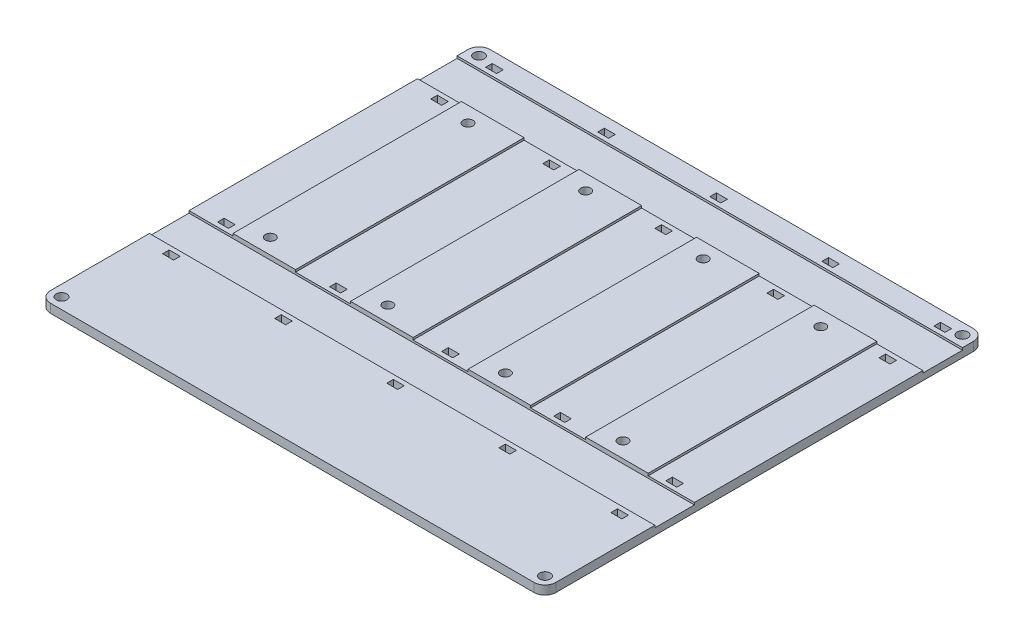
from build123d import *

# Parameters (mm, degrees)
BODY_SKETCH_W                          = 230
BODY_SKETCH_H                          = 200
BODY_DEPTH                             = 4
MOUNTING_HOLES_OUTLINE_R               = 2.4
MOUNTING_HOLES_DEPTH                   = 4
SKETCH4_W                              = 230
SKETCH4_H                              = 18
CABLE_CUTOUTS_DEPTH                    = 1
SKETCH6_W                              = 28.5
SKETCH6_H                              = 104
DRIVER_EXTRUSION_DEPTH                 = 1
DRIVER_MOUNTING_HOLES_OUTLINE_R        = 2.25
DRIVER_MOUNTING_HOLES_DEPTH            = 5
DRIVER_PATTERN_COUNT                   = 4
DRIVER_PATTERN_PITCH                   = 53.5
SKETCH9_W                              = 5
SKETCH9_H                              = 3
CABLE_FIXIATOR_CUTOUT_DEPTH            = 153.449991801
CABLE_FIXIATOR_PATTERN_COUNT           = 5
CABLE_FIXIATOR_PATTERN_PITCH           = 51
CABLE_FIXIATOR_PATTERN_COPY_1_SKETCH_W = 5
CABLE_FIXIATOR_PATTERN_COPY_1_SKETCH_H = 3
CABLE_FIXIATOR_PATTERN_COPY_1_DEPTH    = 153.449991801
CABLE_FIXIATOR_PATTERN_COPY_2_SKETCH_W = 5
CABLE_FIXIATOR_PATTERN_COPY_2_SKETCH_H = 3
CABLE_FIXIATOR_PATTERN_COPY_2_DEPTH    = 153.449991801
CABLE_FIXIATOR_PATTERN_COPY_3_SKETCH_W = 5
CABLE_FIXIATOR_PATTERN_COPY_3_SKETCH_H = 3
CABLE_FIXIATOR_PATTERN_COPY_3_DEPTH    = 153.449991801
CABLE_FIXIATOR_PATTERN_COPY_4_SKETCH_W = 5
CABLE_FIXIATOR_PATTERN_COPY_4_SKETCH_H = 3
CABLE_FIXIATOR_PATTERN_COPY_4_DEPTH    = 153.449991801
EDGE_FILLETS_R                         = 5


# Read off the part's stored shape, not the designer's step: mounting_holes, driver_mounting_holes
with BuildPart() as part:
    # body_sketch → body (new body)
    with BuildSketch(Plane(origin=(0, 0, 0), x_dir=(1, 0, 0), z_dir=(0, 1, 0))):
        Rectangle(BODY_SKETCH_W, BODY_SKETCH_H)
    extrude(amount=BODY_DEPTH)

    # mounting_holes outline → mounting_holes (cut)
    with BuildSketch(Plane(origin=(0, 0, 0), x_dir=(1, 0, 0), z_dir=(0, 1, 0))):
        with Locations((110, -95)):
            Circle(MOUNTING_HOLES_OUTLINE_R)
        with Locations((-110, 95)):
            Circle(MOUNTING_HOLES_OUTLINE_R)
        with Locations((-110, -95)):
            Circle(MOUNTING_HOLES_OUTLINE_R)
        with Locations((110, 95)):
            Circle(MOUNTING_HOLES_OUTLINE_R)
    extrude(amount=MOUNTING_HOLES_DEPTH, mode=Mode.SUBTRACT)

    # Sketch4 → cable_cutouts (cut)
    with BuildSketch(Plane(origin=(0, 4, 0), x_dir=(1, 0, 0), z_dir=(0, 1, 0))):
        with Locations((0, 81)):
            Rectangle(SKETCH4_W, SKETCH4_H)
        with Locations((0, -41)):
            Rectangle(SKETCH4_W, SKETCH4_H)
    extrude(amount=-CABLE_CUTOUTS_DEPTH, mode=Mode.SUBTRACT)

    # Sketch6 → driver_extrusion (add)
    with BuildSketch(Plane(origin=(0, 4, 0), x_dir=(1, 0, 0), z_dir=(0, 1, 0))):
        with Locations((-80.75, 20)):
            Rectangle(SKETCH6_W, SKETCH6_H)
    driver_extrusion = extrude(amount=DRIVER_EXTRUSION_DEPTH)

    # driver_mounting_holes outline → driver_mounting_holes (cut)
    with BuildSketch(Plane(origin=(0, 0, 0), x_dir=(1, 0, 0), z_dir=(0, 1, 0))):
        with Locations((-85, -25)):
            Circle(DRIVER_MOUNTING_HOLES_OUTLINE_R)
        with Locations((-85, 65)):
            Circle(DRIVER_MOUNTING_HOLES_OUTLINE_R)
    driver_mounting_holes = extrude(amount=DRIVER_MOUNTING_HOLES_DEPTH, mode=Mode.SUBTRACT)

    # driver_pattern: driver_extrusion, driver_mounting_holes ×4
    with Locations(*[(i * DRIVER_PATTERN_PITCH, 0, 0) for i in range(1, DRIVER_PATTERN_COUNT)]):
        add(driver_extrusion)
        add(driver_mounting_holes, mode=Mode.SUBTRACT)

    # Sketch9 → cable_fixiator_cutout (cut, through all)
    with BuildSketch(Plane(origin=(0, 4, 0), x_dir=(1, 0, 0), z_dir=(0, 1, 0))):
        with Locations((-101.5, 93.5)):
            Rectangle(SKETCH9_W, SKETCH9_H)
        with Locations((-101.5, 68.5)):
            Rectangle(SKETCH9_W, SKETCH9_H)
    cable_fixiator_cutout = extrude(amount=-CABLE_FIXIATOR_CUTOUT_DEPTH, mode=Mode.SUBTRACT)

    # cable_fixiator_mirror: cable_fixiator_cutout across plane
    add(cable_fixiator_cutout.mirror(Plane.XY.offset(-20)), mode=Mode.SUBTRACT)

    # cable_fixiator_pattern: cable_fixiator_cutout ×5
    with Locations(*[(i * CABLE_FIXIATOR_PATTERN_PITCH, 0, 0) for i in range(1, CABLE_FIXIATOR_PATTERN_COUNT)]):
        add(cable_fixiator_cutout, mode=Mode.SUBTRACT)

    # cable_fixiator_pattern copy 1 sketch → cable_fixiator_pattern copy 1 (cut, through all)
    with BuildSketch(Plane(origin=(51, 4, -40), x_dir=(1, 0, 0), z_dir=(0, 1, 0))):
        with Locations((-101.5, -93.5)):
            Rectangle(CABLE_FIXIATOR_PATTERN_COPY_1_SKETCH_W, CABLE_FIXIATOR_PATTERN_COPY_1_SKETCH_H)
        with Locations((-101.5, -68.5)):
            Rectangle(CABLE_FIXIATOR_PATTERN_COPY_1_SKETCH_W, CABLE_FIXIATOR_PATTERN_COPY_1_SKETCH_H)
    extrude(amount=-CABLE_FIXIATOR_PATTERN_COPY_1_DEPTH, mode=Mode.SUBTRACT)

    # cable_fixiator_pattern copy 2 sketch → cable_fixiator_pattern copy 2 (cut, through all)
    with BuildSketch(Plane(origin=(102, 4, -40), x_dir=(1, 0, 0), z_dir=(0, 1, 0))):
        with Locations((-101.5, -93.5)):
            Rectangle(CABLE_FIXIATOR_PATTERN_COPY_2_SKETCH_W, CABLE_FIXIATOR_PATTERN_COPY_2_SKETCH_H)
        with Locations((-101.5, -68.5)):
            Rectangle(CABLE_FIXIATOR_PATTERN_COPY_2_SKETCH_W, CABLE_FIXIATOR_PATTERN_COPY_2_SKETCH_H)
    extrude(amount=-CABLE_FIXIATOR_PATTERN_COPY_2_DEPTH, mode=Mode.SUBTRACT)

    # cable_fixiator_pattern copy 3 sketch → cable_fixiator_pattern copy 3 (cut, through all)
    with BuildSketch(Plane(origin=(153, 4, -40), x_dir=(1, 0, 0), z_dir=(0, 1, 0))):
        with Locations((-101.5, -93.5)):
            Rectangle(CABLE_FIXIATOR_PATTERN_COPY_3_SKETCH_W, CABLE_FIXIATOR_PATTERN_COPY_3_SKETCH_H)
        with Locations((-101.5, -68.5)):
            Rectangle(CABLE_FIXIATOR_PATTERN_COPY_3_SKETCH_W, CABLE_FIXIATOR_PATTERN_COPY_3_SKETCH_H)
    extrude(amount=-CABLE_FIXIATOR_PATTERN_COPY_3_DEPTH, mode=Mode.SUBTRACT)

    # cable_fixiator_pattern copy 4 sketch → cable_fixiator_pattern copy 4 (cut, through all)
    with BuildSketch(Plane(origin=(204, 4, -40), x_dir=(1, 0, 0), z_dir=(0, 1, 0))):
        with Locations((-101.5, -93.5)):
            Rectangle(CABLE_FIXIATOR_PATTERN_COPY_4_SKETCH_W, CABLE_FIXIATOR_PATTERN_COPY_4_SKETCH_H)
        with Locations((-101.5, -68.5)):
            Rectangle(CABLE_FIXIATOR_PATTERN_COPY_4_SKETCH_W, CABLE_FIXIATOR_PATTERN_COPY_4_SKETCH_H)
    extrude(amount=-CABLE_FIXIATOR_PATTERN_COPY_4_DEPTH, mode=Mode.SUBTRACT)

    # edge_fillets
    edge_fillets_edges = [part.edges().sort_by_distance(p)[0] for p in [
        (115, 2, 100),
        (-115, 2, 100),
        (-115, 2, -100),
        (115, 2, -100),
    ]]
    fillet(edge_fillets_edges, radius=EDGE_FILLETS_R)


solid = part.part
